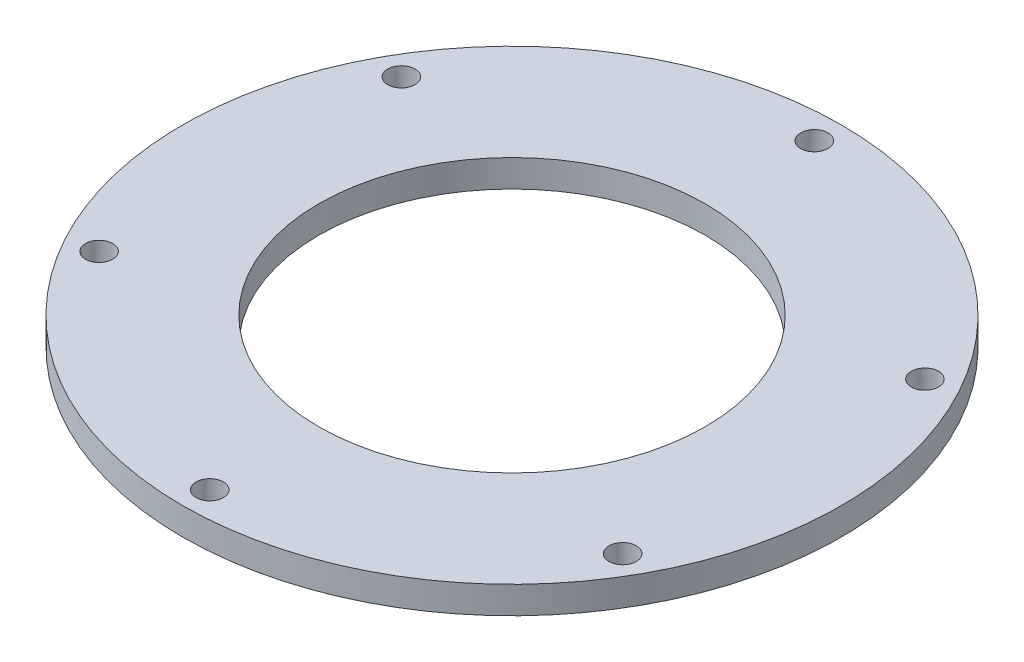
from build123d import *

# Parameters (mm, degrees)
SKETCH1_R           = 36.25
SKETCH1_R_2         = 21.25
BOSS_EXTRUDE1_DEPTH = 3
SKETCH2_R           = 1.5
CUT_EXTRUDE1_DEPTH  = 52.352945388
CIRPATTERN1_COUNT   = 6


with BuildPart() as part:
    # Sketch1 → Boss-Extrude1 (new body)
    with BuildSketch(Plane(origin=(0, 0, 0), x_dir=(1, 0, 0), z_dir=(0, 1, 0))):
        Circle(SKETCH1_R)
        Circle(SKETCH1_R_2, mode=Mode.SUBTRACT)
    extrude(amount=BOSS_EXTRUDE1_DEPTH)

    # Sketch2 → Cut-Extrude1 (cut, symmetric)
    with BuildSketch(Plane(origin=(0, 3, 0), x_dir=(1, 0, 0), z_dir=(0, 1, 0))):
        with Locations((0, 33.25)):
            Circle(SKETCH2_R)
    cut_extrude1 = extrude(amount=CUT_EXTRUDE1_DEPTH, both=True, mode=Mode.SUBTRACT)

    # CirPattern1: Cut-Extrude1 ×6 about axis
    cirpattern1_axis = Axis((0, 3, 0), (0, -1, 0))
    for i in range(1, CIRPATTERN1_COUNT):
        add(cut_extrude1.rotate(cirpattern1_axis, i * 360 / CIRPATTERN1_COUNT), mode=Mode.SUBTRACT)


solid = part.part
